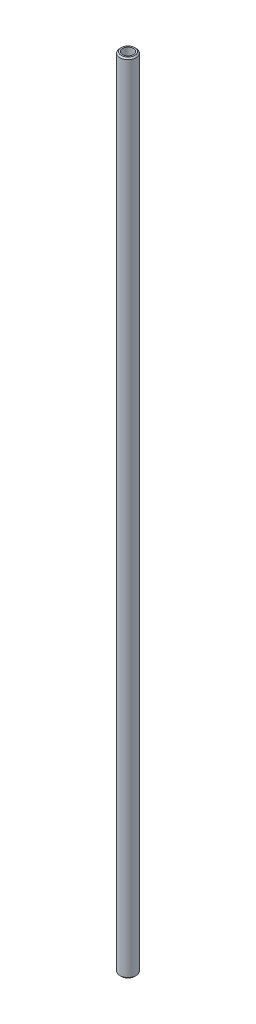
from build123d import *

# Parameters (mm, degrees)
ESQUISSE2_R        = 3
ESQUISSE2_R_2      = 2
BOSS_EXTRU_1_DEPTH = 295
CHANFREIN1_SIZE    = 0.5


with BuildPart() as part:
    # Esquisse2 → Boss.-Extru.1 (new body)
    with BuildSketch(Plane(origin=(0, 0, 0), x_dir=(1, 0, 0), z_dir=(0, 1, 0))):
        with Locations((4080.637245623, -774.210455382)):
            Circle(ESQUISSE2_R)
        with Locations((4080.637245623, -774.210455382)):
            Circle(ESQUISSE2_R_2, mode=Mode.SUBTRACT)
    extrude(amount=BOSS_EXTRU_1_DEPTH)

    # Chanfrein1
    chanfrein1_edges = [part.edges().sort_by_distance(p)[0] for p in [
        (4077.637245623, 295, 774.210455382),
        (4077.637245623, 0, 774.210455382),
    ]]
    chamfer(chanfrein1_edges, length=CHANFREIN1_SIZE)


solid = part.part
